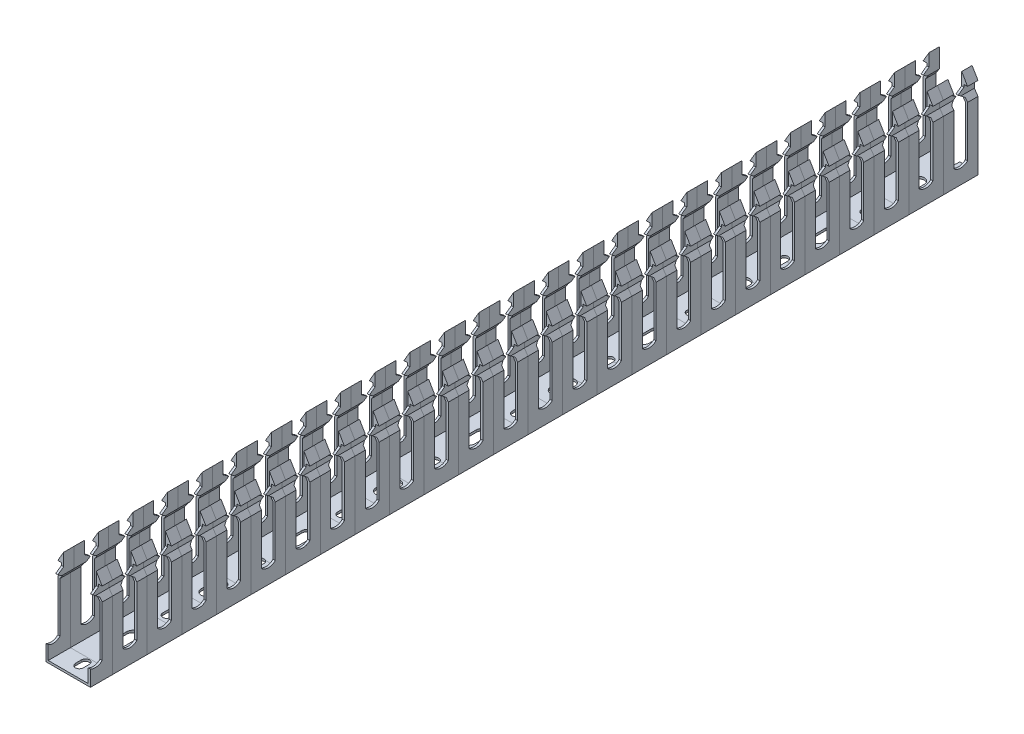
from build123d import *

# Parameters (mm, degrees)
SKETCH1_W           = 25.4
SKETCH1_H           = 52.578
BOSS_EXTRUDE1_DEPTH = 19.812
CUT_EXTRUDE2_REACH  = 43.579
CUT_EXTRUDE3_REACH  = 37.283
LPATTERN1_COUNT     = 26
LPATTERN1_PITCH     = 19.812
CUT_EXTRUDE4_START  = -52.578
SKETCH4_W           = 38.1
SKETCH4_H           = 12.7
CUT_EXTRUDE4_DEPTH  = 52.578
CUT_EXTRUDE6_DEPTH  = 1.27
LPATTERN2_COUNT     = 11
LPATTERN2_PITCH     = 49.9872


with BuildPart() as part:
    # Sketch1 → Boss-Extrude1 (new body)
    with BuildSketch(Plane.XY):
        Rectangle(SKETCH1_W, SKETCH1_H)
    extrude(amount=BOSS_EXTRUDE1_DEPTH)

    # Sketch2 → Cut-Extrude2 (cut, up to next)
    with BuildSketch(Plane(origin=(12.7, 0, 0), x_dir=(0, 0, -1), z_dir=(1, 0, 0)), mode=Mode.PRIVATE) as cut_extrude2_sk1:
        with BuildLine():
            Line((-5.969, 26.289), (-5.969, 19.14525))
            Line((-5.969, 19.14525), (-9.271, 16.764))
            Line((-9.271, 16.764), (-5.969, 14.38275))
            Line((-5.969, 14.38275), (-5.969, -16.3195))
            ThreePointArc((-5.969, -16.3195), (-9.906, -17.950258795), (-13.843, -16.3195))
            Line((-13.843, -16.3195), (-13.843, 14.38275))
            Line((-13.843, 14.38275), (-10.541, 16.764))
            Line((-10.541, 16.764), (-13.843, 19.14525))
            Line((-13.843, 19.14525), (-13.843, 26.289))
            Line((-13.843, 26.289), (-5.969, 26.289))
        make_face()
    cut_extrude2_tool1 = extrude(cut_extrude2_sk1.sketch, amount=-CUT_EXTRUDE2_REACH, mode=Mode.PRIVATE) & part.part
    add(cut_extrude2_tool1.solids().sort_by_distance((12.7, 3.829699, 9.906))[0], mode=Mode.SUBTRACT)

    # Cut-Extrude3: up to this face of the body (flat: up to its plane)
    cut_extrude3_end = Plane(part.part.faces().sort_by_distance((0, 0, 0))[0])
    # Sketch3 → Cut-Extrude3 (cut, up to the picked face)
    with BuildSketch(Plane.XY.offset(19.812), mode=Mode.PRIVATE) as cut_extrude3_sk1:
        Polygon((-11.43, 12.233095613), (-11.43, -25.019), (11.43, -25.019), (11.43, 12.233095613), (9.333854135, 15.244149859), (9.333854135, 26.289), (12.7, 20.563100435), (10.603854135, 20.563100435), (10.603854135, 15.642675827), (13.678753226, 11.225670256), (13.678753226, 29.890539635), (-13.678753226, 29.890539635), (-13.678753226, 11.225670256), (-10.603854135, 15.642675827), (-10.603854135, 20.563100435), (-12.7, 20.563100435), (-9.333854135, 26.289), (-9.333854135, 15.244149859), align=None)
    cut_extrude3_tool1 = split(extrude(cut_extrude3_sk1.sketch, amount=-CUT_EXTRUDE3_REACH, mode=Mode.PRIVATE), bisect_by=cut_extrude3_end, keep=Keep.BOTH, mode=Mode.PRIVATE)
    add(cut_extrude3_tool1.solids().sort_by(Axis((0, 3.042009, 19.812), (0, 0, -1)))[0], mode=Mode.SUBTRACT)


with BuildPart() as lpattern1_1:
    # LPattern1: pattern copy
    add(part.part.moved(Location(Vector(0, 0, 1) * (1 * LPATTERN1_PITCH))))


with BuildPart() as lpattern1_2:
    # LPattern1: pattern copy
    add(part.part.moved(Location(Vector(0, 0, 1) * (2 * LPATTERN1_PITCH))))


with BuildPart() as lpattern1_3:
    # LPattern1: pattern copy
    add(part.part.moved(Location(Vector(0, 0, 1) * (3 * LPATTERN1_PITCH))))


with BuildPart() as lpattern1_4:
    # LPattern1: pattern copy
    add(part.part.moved(Location(Vector(0, 0, 1) * (4 * LPATTERN1_PITCH))))


with BuildPart() as lpattern1_5:
    # LPattern1: pattern copy
    add(part.part.moved(Location(Vector(0, 0, 1) * (5 * LPATTERN1_PITCH))))


with BuildPart() as lpattern1_6:
    # LPattern1: pattern copy
    add(part.part.moved(Location(Vector(0, 0, 1) * (6 * LPATTERN1_PITCH))))


with BuildPart() as lpattern1_7:
    # LPattern1: pattern copy
    add(part.part.moved(Location(Vector(0, 0, 1) * (7 * LPATTERN1_PITCH))))


with BuildPart() as lpattern1_8:
    # LPattern1: pattern copy
    add(part.part.moved(Location(Vector(0, 0, 1) * (8 * LPATTERN1_PITCH))))


with BuildPart() as lpattern1_9:
    # LPattern1: pattern copy
    add(part.part.moved(Location(Vector(0, 0, 1) * (9 * LPATTERN1_PITCH))))


with BuildPart() as lpattern1_10:
    # LPattern1: pattern copy
    add(part.part.moved(Location(Vector(0, 0, 1) * (10 * LPATTERN1_PITCH))))


with BuildPart() as lpattern1_11:
    # LPattern1: pattern copy
    add(part.part.moved(Location(Vector(0, 0, 1) * (11 * LPATTERN1_PITCH))))


with BuildPart() as lpattern1_12:
    # LPattern1: pattern copy
    add(part.part.moved(Location(Vector(0, 0, 1) * (12 * LPATTERN1_PITCH))))


with BuildPart() as lpattern1_13:
    # LPattern1: pattern copy
    add(part.part.moved(Location(Vector(0, 0, 1) * (13 * LPATTERN1_PITCH))))


with BuildPart() as lpattern1_14:
    # LPattern1: pattern copy
    add(part.part.moved(Location(Vector(0, 0, 1) * (14 * LPATTERN1_PITCH))))


with BuildPart() as lpattern1_15:
    # LPattern1: pattern copy
    add(part.part.moved(Location(Vector(0, 0, 1) * (15 * LPATTERN1_PITCH))))


with BuildPart() as lpattern1_16:
    # LPattern1: pattern copy
    add(part.part.moved(Location(Vector(0, 0, 1) * (16 * LPATTERN1_PITCH))))


with BuildPart() as lpattern1_17:
    # LPattern1: pattern copy
    add(part.part.moved(Location(Vector(0, 0, 1) * (17 * LPATTERN1_PITCH))))


with BuildPart() as lpattern1_18:
    # LPattern1: pattern copy
    add(part.part.moved(Location(Vector(0, 0, 1) * (18 * LPATTERN1_PITCH))))


with BuildPart() as lpattern1_19:
    # LPattern1: pattern copy
    add(part.part.moved(Location(Vector(0, 0, 1) * (19 * LPATTERN1_PITCH))))


with BuildPart() as lpattern1_20:
    # LPattern1: pattern copy
    add(part.part.moved(Location(Vector(0, 0, 1) * (20 * LPATTERN1_PITCH))))


with BuildPart() as lpattern1_21:
    # LPattern1: pattern copy
    add(part.part.moved(Location(Vector(0, 0, 1) * (21 * LPATTERN1_PITCH))))


with BuildPart() as lpattern1_22:
    # LPattern1: pattern copy
    add(part.part.moved(Location(Vector(0, 0, 1) * (22 * LPATTERN1_PITCH))))


with BuildPart() as lpattern1_23:
    # LPattern1: pattern copy
    add(part.part.moved(Location(Vector(0, 0, 1) * (23 * LPATTERN1_PITCH))))


with BuildPart() as lpattern1_24:
    # LPattern1: pattern copy
    add(part.part.moved(Location(Vector(0, 0, 1) * (24 * LPATTERN1_PITCH))))


with BuildPart() as lpattern1_25:
    # LPattern1: pattern copy
    add(part.part.moved(Location(Vector(0, 0, 1) * (25 * LPATTERN1_PITCH))))

    # Sketch4 → Cut-Extrude4 (cut)
    with BuildSketch(Plane.XZ.offset(26.289).offset(CUT_EXTRUDE4_START)):
        with Locations((0, 514.35)):
            Rectangle(SKETCH4_W, SKETCH4_H)
    extrude(amount=CUT_EXTRUDE4_DEPTH, mode=Mode.SUBTRACT)


with BuildPart() as cut_extrude4_kept_piece:
    # of the separate pieces the step leaves, the one the design keeps (cut_extrude4_pieces_kept)
    add(lpattern1_25.part.solids().sort_by_distance((-12.7, -26.289, 495.3))[0])


with BuildPart() as cut_extrude6_tool:
    # Sketch6 → Cut-Extrude6 (new body)
    with BuildSketch(Plane.XZ.offset(26.289)):
        with BuildLine():
            Line((-2.2479, -1.7526), (-2.2479, 1.7526))
            ThreePointArc((-2.2479, 1.7526), (0, 4.0005), (2.2479, 1.7526))
            Line((2.2479, 1.7526), (2.2479, -1.7526))
            ThreePointArc((2.2479, -1.7526), (0, -4.0005), (-2.2479, -1.7526))
        make_face()
        with BuildLine():
            Line((-3.2512, 21.2471), (-3.2512, 28.7401))
            ThreePointArc((-3.2512, 28.7401), (0, 31.9913), (3.2512, 28.7401))
            Line((3.2512, 28.7401), (3.2512, 21.2471))
            ThreePointArc((3.2512, 21.2471), (0, 17.9959), (-3.2512, 21.2471))
        make_face()
    cut_extrude6 = extrude(amount=-CUT_EXTRUDE6_DEPTH)


with BuildPart() as part_1:
    add(part.part)

    # Cut-Extrude6: cut by cut_extrude6_tool
    add(cut_extrude6_tool.part, mode=Mode.SUBTRACT)


with BuildPart() as lpattern1_1_1:
    add(lpattern1_1.part)

    # Cut-Extrude6: cut by cut_extrude6_tool
    add(cut_extrude6_tool.part, mode=Mode.SUBTRACT)


with BuildPart() as lpattern2_tool:
    # LPattern2: Cut-Extrude6 ×11
    with Locations(*[(0, 0, i * LPATTERN2_PITCH) for i in range(1, LPATTERN2_COUNT)]):
        add(cut_extrude6)


with BuildPart() as lpattern1_2_1:
    add(lpattern1_2.part)

    # LPattern2: cut by lpattern2_tool
    add(lpattern2_tool.part, mode=Mode.SUBTRACT)


with BuildPart() as lpattern1_3_1:
    add(lpattern1_3.part)

    # LPattern2: cut by lpattern2_tool
    add(lpattern2_tool.part, mode=Mode.SUBTRACT)


with BuildPart() as lpattern1_4_1:
    add(lpattern1_4.part)

    # LPattern2: cut by lpattern2_tool
    add(lpattern2_tool.part, mode=Mode.SUBTRACT)


with BuildPart() as lpattern1_5_1:
    add(lpattern1_5.part)

    # LPattern2: cut by lpattern2_tool
    add(lpattern2_tool.part, mode=Mode.SUBTRACT)


with BuildPart() as lpattern1_6_1:
    add(lpattern1_6.part)

    # LPattern2: cut by lpattern2_tool
    add(lpattern2_tool.part, mode=Mode.SUBTRACT)


with BuildPart() as lpattern1_7_1:
    add(lpattern1_7.part)

    # LPattern2: cut by lpattern2_tool
    add(lpattern2_tool.part, mode=Mode.SUBTRACT)


with BuildPart() as lpattern1_8_1:
    add(lpattern1_8.part)

    # LPattern2: cut by lpattern2_tool
    add(lpattern2_tool.part, mode=Mode.SUBTRACT)


with BuildPart() as lpattern1_9_1:
    add(lpattern1_9.part)

    # LPattern2: cut by lpattern2_tool
    add(lpattern2_tool.part, mode=Mode.SUBTRACT)


with BuildPart() as lpattern1_10_1:
    add(lpattern1_10.part)

    # LPattern2: cut by lpattern2_tool
    add(lpattern2_tool.part, mode=Mode.SUBTRACT)


with BuildPart() as lpattern1_11_1:
    add(lpattern1_11.part)

    # LPattern2: cut by lpattern2_tool
    add(lpattern2_tool.part, mode=Mode.SUBTRACT)


with BuildPart() as lpattern1_12_1:
    add(lpattern1_12.part)

    # LPattern2: cut by lpattern2_tool
    add(lpattern2_tool.part, mode=Mode.SUBTRACT)


with BuildPart() as lpattern1_13_1:
    add(lpattern1_13.part)

    # LPattern2: cut by lpattern2_tool
    add(lpattern2_tool.part, mode=Mode.SUBTRACT)


with BuildPart() as lpattern1_14_1:
    add(lpattern1_14.part)

    # LPattern2: cut by lpattern2_tool
    add(lpattern2_tool.part, mode=Mode.SUBTRACT)


with BuildPart() as lpattern1_15_1:
    add(lpattern1_15.part)

    # LPattern2: cut by lpattern2_tool
    add(lpattern2_tool.part, mode=Mode.SUBTRACT)


with BuildPart() as lpattern1_16_1:
    add(lpattern1_16.part)

    # LPattern2: cut by lpattern2_tool
    add(lpattern2_tool.part, mode=Mode.SUBTRACT)


with BuildPart() as lpattern1_17_1:
    add(lpattern1_17.part)

    # LPattern2: cut by lpattern2_tool
    add(lpattern2_tool.part, mode=Mode.SUBTRACT)


with BuildPart() as lpattern1_18_1:
    add(lpattern1_18.part)

    # LPattern2: cut by lpattern2_tool
    add(lpattern2_tool.part, mode=Mode.SUBTRACT)


with BuildPart() as lpattern1_19_1:
    add(lpattern1_19.part)

    # LPattern2: cut by lpattern2_tool
    add(lpattern2_tool.part, mode=Mode.SUBTRACT)


with BuildPart() as lpattern1_20_1:
    add(lpattern1_20.part)

    # LPattern2: cut by lpattern2_tool
    add(lpattern2_tool.part, mode=Mode.SUBTRACT)


with BuildPart() as lpattern1_21_1:
    add(lpattern1_21.part)

    # LPattern2: cut by lpattern2_tool
    add(lpattern2_tool.part, mode=Mode.SUBTRACT)


with BuildPart() as lpattern1_22_1:
    add(lpattern1_22.part)

    # LPattern2: cut by lpattern2_tool
    add(lpattern2_tool.part, mode=Mode.SUBTRACT)


with BuildPart() as lpattern1_23_1:
    add(lpattern1_23.part)

    # LPattern2: cut by lpattern2_tool
    add(lpattern2_tool.part, mode=Mode.SUBTRACT)


with BuildPart() as lpattern1_24_1:
    add(lpattern1_24.part)

    # LPattern2: cut by lpattern2_tool
    add(lpattern2_tool.part, mode=Mode.SUBTRACT)


with BuildPart() as cut_extrude4_kept_piece_1:
    add(cut_extrude4_kept_piece.part)

    # LPattern2: cut by lpattern2_tool
    add(lpattern2_tool.part, mode=Mode.SUBTRACT)


solid = Compound([part_1.part, lpattern1_1_1.part, lpattern1_2_1.part, lpattern1_3_1.part, lpattern1_4_1.part, lpattern1_5_1.part, lpattern1_6_1.part, lpattern1_7_1.part, lpattern1_8_1.part, lpattern1_9_1.part, lpattern1_10_1.part, lpattern1_11_1.part, lpattern1_12_1.part, lpattern1_13_1.part, lpattern1_14_1.part, lpattern1_15_1.part, lpattern1_16_1.part, lpattern1_17_1.part, lpattern1_18_1.part, lpattern1_19_1.part, lpattern1_20_1.part, lpattern1_21_1.part, lpattern1_22_1.part, lpattern1_23_1.part, lpattern1_24_1.part, cut_extrude4_kept_piece_1.part])
